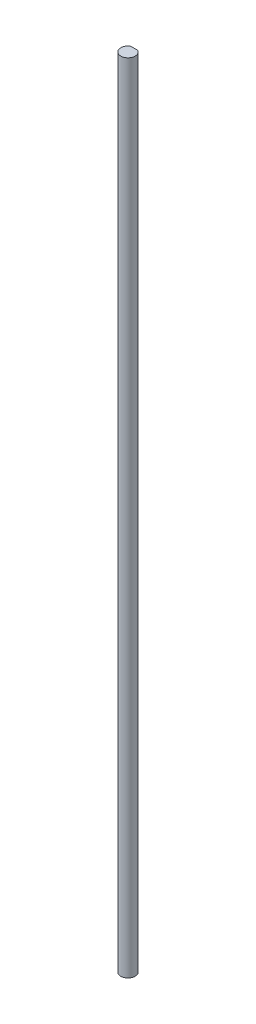
from build123d import *

# Parameters (mm, degrees)
BOSS_EXTRUDE1_DEPTH = 350


with BuildPart() as part:
    # Sketch1 → Boss-Extrude1 (new body)
    with BuildSketch(Plane(origin=(0, 0, 0), x_dir=(1, 0, 0), z_dir=(0, 1, 0))):
        with BuildLine():
            Line((-1.5875, 2.749630657), (1.5875, 2.749630657))
            ThreePointArc((1.5875, 2.749630657), (0, -3.175), (-1.5875, 2.749630657))
        make_face()
    extrude(amount=BOSS_EXTRUDE1_DEPTH)


solid = part.part
